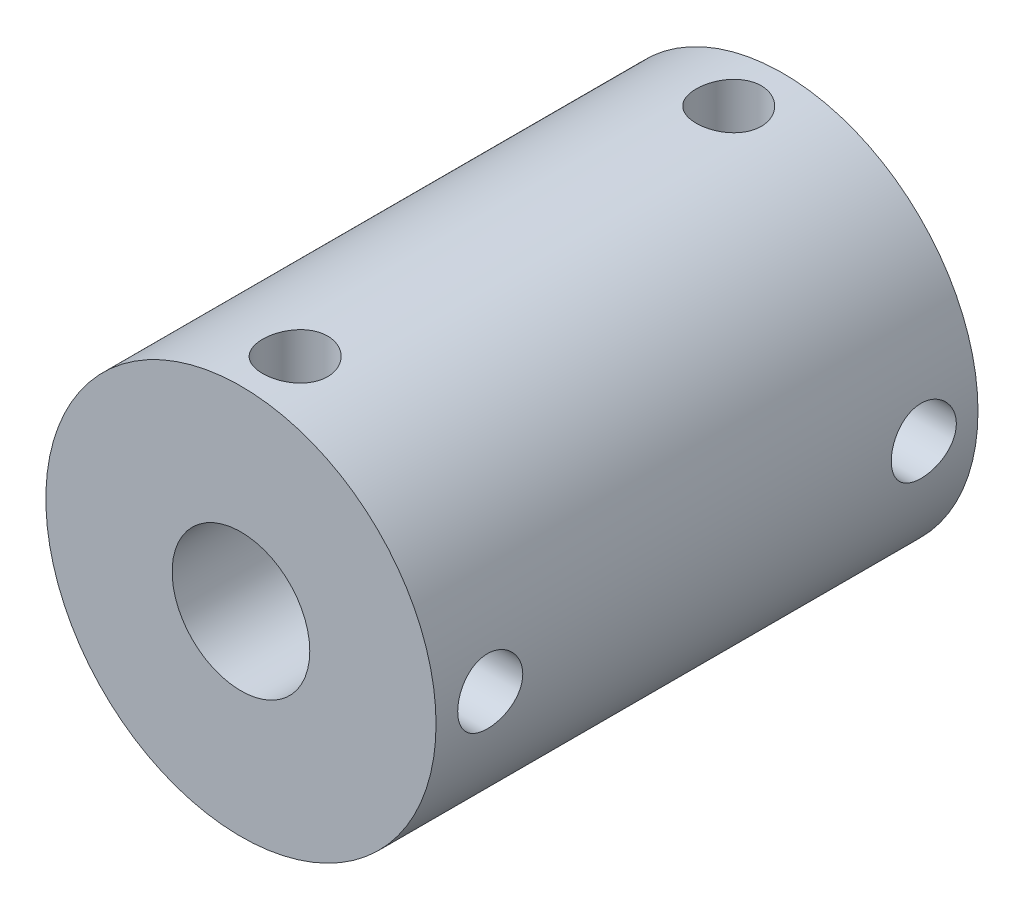
from build123d import *

# Parameters (mm, degrees)
SKETCH1_R           = 9
BOSS_EXTRUDE1_DEPTH = 12.5
SKETCH2_R           = 3.175
CUT_EXTRUDE1_DEPTH  = 29.053520278
SKETCH3_R           = 1.5
CUT_EXTRUDE2_DEPTH  = 18.839562775
SKETCH4_R           = 1.5
CUT_EXTRUDE3_DEPTH  = 18.839562962


with BuildPart() as part:
    # Sketch1 → Boss-Extrude1 (new, symmetric)
    with BuildSketch(Plane.XY):
        Circle(SKETCH1_R)
    extrude(amount=BOSS_EXTRUDE1_DEPTH, both=True)

    # Sketch2 → Cut-Extrude1 (cut, through all)
    with BuildSketch(Plane.XY.offset(12.5)):
        Circle(SKETCH2_R)
    extrude(amount=-CUT_EXTRUDE1_DEPTH, mode=Mode.SUBTRACT)

    # Sketch3 → Cut-Extrude2 (cut, through all)
    with BuildSketch(Plane(origin=(0, 0, 0), x_dir=(1, 0, 0), z_dir=(0, 1, 0))):
        with Locations((0, 10)):
            Circle(SKETCH3_R)
        with Locations((0, -10)):
            Circle(SKETCH3_R)
    extrude(amount=CUT_EXTRUDE2_DEPTH, mode=Mode.SUBTRACT)

    # Sketch4 → Cut-Extrude3 (cut, through all)
    with BuildSketch(Plane(origin=(0, 0, 0), x_dir=(0, 0, -1), z_dir=(1, 0, 0))):
        with Locations((-10, 0)):
            Circle(SKETCH4_R)
        with Locations((10, 0)):
            Circle(SKETCH4_R)
    extrude(amount=CUT_EXTRUDE3_DEPTH, mode=Mode.SUBTRACT)


solid = part.part
